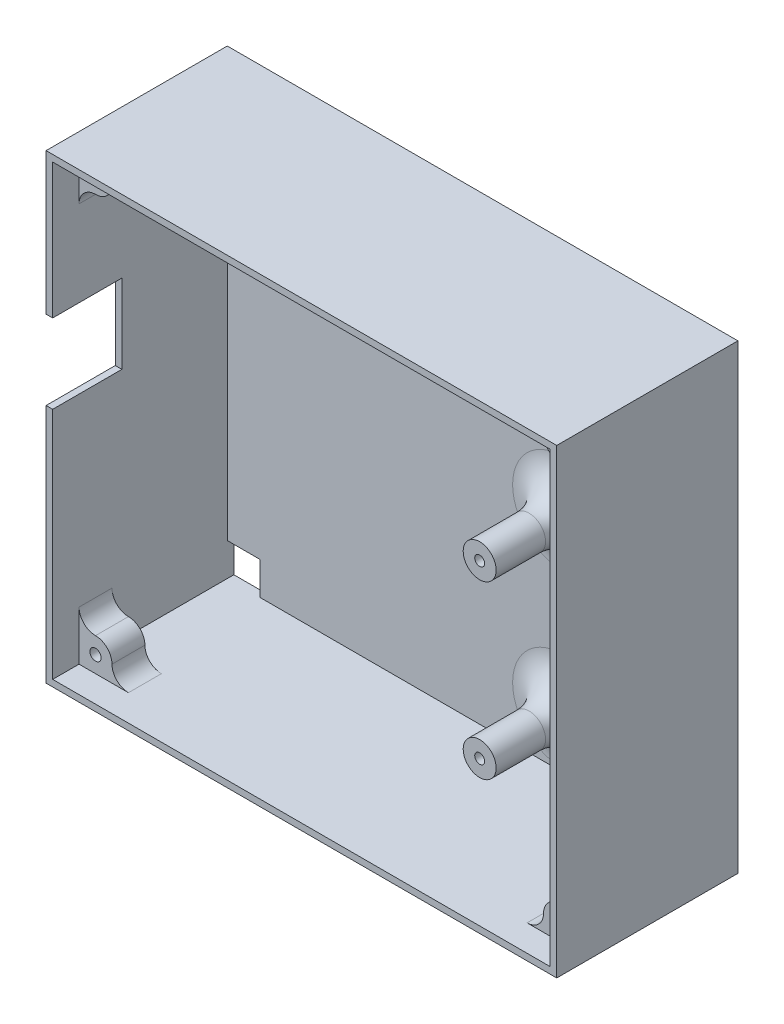
from build123d import *

# Parameters (mm, degrees)
SKIZZE1_W                            = 155
SKIZZE1_H                            = 140
AUFSATZ_LINEAR_AUSTRAGEN2_DEPTH      = 55
WANDUNG3_T                           = -2
SKIZZE2_W                            = 21
SKIZZE2_H                            = 24
SCHNITT_LINEAR_AUSTRAGEN1_DEPTH      = 2
SKIZZE3_R                            = 5
AUFSATZ_LINEAR_AUSTRAGEN5_DEPTH      = 25
VERRUNDUNG1_R                        = 10
F_3_0_3_DURCHMESSER_BOHRUNG1_D       = 3
F_3_0_3_DURCHMESSER_BOHRUNG1_DEPTH   = 20
F_3_0_3_DURCHMESSER_BOHRUNG1_TIP     = 0.901290929
SCHNITT_LINEAR_AUSTRAGEN2_REACH      = 119.112
SKIZZE6_W                            = 10
SKIZZE6_H                            = 10
AUFSATZ_LINEAR_AUSTRAGEN7_DEPTH      = 10
VERRUNDUNG3_R                        = 5
F_3_4_3_4_DURCHMESSER_BOHRUNG1_D     = 3.4
SKIZZE12_R                           = 5
AUFSATZ_LINEAR_AUSTRAGEN8_DEPTH      = 10
VERRUNDUNG4_R                        = 5
F_3_4_3_4_DURCHMESSER_BOHRUNG2_D     = 3.4
F_3_4_3_4_DURCHMESSER_BOHRUNG2_DEPTH = 10
F_3_4_3_4_DURCHMESSER_BOHRUNG2_TIP   = 1.021463052


with BuildPart() as part:
    # Skizze1 → Aufsatz-Linear austragen2 (new body)
    with BuildSketch(Plane.XY):
        Rectangle(SKIZZE1_W, SKIZZE1_H)
    extrude(amount=AUFSATZ_LINEAR_AUSTRAGEN2_DEPTH)

    # Wandung3
    wandung3_openings = [part.faces().sort_by_distance(p)[0] for p in [
        (0, 0, 55),
    ]]
    offset(amount=WANDUNG3_T, openings=wandung3_openings, kind=Kind.INTERSECTION)

    # Skizze2 → Schnitt-Linear austragen1 (cut)
    with BuildSketch(Plane.ZY.offset(77.5)):
        with Locations((44.5, 15)):
            Rectangle(SKIZZE2_W, SKIZZE2_H)
    extrude(amount=-SCHNITT_LINEAR_AUSTRAGEN1_DEPTH, mode=Mode.SUBTRACT)

    # Skizze3 → Aufsatz-Linear austragen5 (add)
    with BuildSketch(Plane.XY.offset(2)):
        with Locations(Location((26.111301189, -52, 0), (0, 0, 180))):
            Circle(SKIZZE3_R)
        with Locations(Location((26.111301189, 0, 0), (0, 0, 180))):
            Circle(SKIZZE3_R)
    extrude(amount=AUFSATZ_LINEAR_AUSTRAGEN5_DEPTH)

    # Verrundung1
    verrundung1_edges = [part.edges().sort_by_distance(p)[0] for p in [
        (31.111301189, -52, 2),
        (31.111301189, 0, 2),
    ]]
    fillet(verrundung1_edges, radius=VERRUNDUNG1_R)

    # Ø3.0 (3) Durchmesser Bohrung1
    with Locations(Plane.XY.offset(27)):
        with Locations((26.111301189, 0), (26.111301189, -52)):
            Hole(F_3_0_3_DURCHMESSER_BOHRUNG1_D / 2, depth=F_3_0_3_DURCHMESSER_BOHRUNG1_DEPTH)
            with Locations((0, 0, -(F_3_0_3_DURCHMESSER_BOHRUNG1_DEPTH + F_3_0_3_DURCHMESSER_BOHRUNG1_TIP / 2))):  # 118° drill point
                Cone(0, F_3_0_3_DURCHMESSER_BOHRUNG1_D / 2, F_3_0_3_DURCHMESSER_BOHRUNG1_TIP, mode=Mode.SUBTRACT)

    # Skizze6 → Schnitt-Linear austragen2 (cut, up to next)
    with BuildSketch(Plane.XY.offset(2), mode=Mode.PRIVATE) as schnitt_linear_austragen2_sk1:
        with Locations((-70.5, -63)):
            Rectangle(SKIZZE6_W, SKIZZE6_H)
    schnitt_linear_austragen2_tool1 = extrude(schnitt_linear_austragen2_sk1.sketch, amount=-SCHNITT_LINEAR_AUSTRAGEN2_REACH, mode=Mode.PRIVATE) & part.part
    # Skizze6 → Schnitt-Linear austragen2 (cut, up to next)
    with BuildSketch(Plane.XY.offset(2), mode=Mode.PRIVATE) as schnitt_linear_austragen2_sk2:
        with Locations((70.5, -63)):
            Rectangle(SKIZZE6_W, SKIZZE6_H)
    schnitt_linear_austragen2_tool2 = extrude(schnitt_linear_austragen2_sk2.sketch, amount=-SCHNITT_LINEAR_AUSTRAGEN2_REACH, mode=Mode.PRIVATE) & part.part
    # Skizze6 → Schnitt-Linear austragen2 (cut, up to next)
    with BuildSketch(Plane.XY.offset(2), mode=Mode.PRIVATE) as schnitt_linear_austragen2_sk3:
        with Locations((70.5, 63)):
            Rectangle(SKIZZE6_W, SKIZZE6_H)
    schnitt_linear_austragen2_tool3 = extrude(schnitt_linear_austragen2_sk3.sketch, amount=-SCHNITT_LINEAR_AUSTRAGEN2_REACH, mode=Mode.PRIVATE) & part.part
    # Skizze6 → Schnitt-Linear austragen2 (cut, up to next)
    with BuildSketch(Plane.XY.offset(2), mode=Mode.PRIVATE) as schnitt_linear_austragen2_sk4:
        with Locations((-70.5, 63)):
            Rectangle(SKIZZE6_W, SKIZZE6_H)
    schnitt_linear_austragen2_tool4 = extrude(schnitt_linear_austragen2_sk4.sketch, amount=-SCHNITT_LINEAR_AUSTRAGEN2_REACH, mode=Mode.PRIVATE) & part.part
    add(schnitt_linear_austragen2_tool1.solids().sort_by_distance((-70.5, -63, 2))[0], mode=Mode.SUBTRACT)
    add(schnitt_linear_austragen2_tool2.solids().sort_by_distance((70.5, -63, 2))[0], mode=Mode.SUBTRACT)
    add(schnitt_linear_austragen2_tool3.solids().sort_by_distance((70.5, 63, 2))[0], mode=Mode.SUBTRACT)
    add(schnitt_linear_austragen2_tool4.solids().sort_by_distance((-70.5, 63, 2))[0], mode=Mode.SUBTRACT)

    # 3D-Skizze1 → Aufsatz-Linear austragen7 (add)
    with BuildSketch(Plane(origin=(-75.5, 68, 47), x_dir=(0.7430494130276538, -0.6692365574288803, 0), z_dir=(0, 0, 1))):
        Polygon((0, 0), (7.43049413, 6.692365574), (14.122859705, -0.738128556), (6.692365574, -7.43049413), align=None)
        Polygon((112.200461367, 101.054720172), (104.769967237, 94.362354597), (111.462332811, 86.931860467), (118.892826941, 93.624226041), align=None)
        Polygon((203.216633178, 0), (195.786139047, -6.692365574), (189.093773473, 0.738128556), (196.524267603, 7.43049413), align=None)
        Polygon((91.01617181, -101.054720172), (98.446665941, -94.362354597), (91.754300366, -86.931860467), (84.323806236, -93.624226041), align=None)
    extrude(amount=-AUFSATZ_LINEAR_AUSTRAGEN7_DEPTH)

    # Verrundung3
    verrundung3_edges = [part.edges().sort_by_distance(p)[0] for p in [
        (-65.5, -58, 42),
        (-65.5, -68, 42),
        (-75.5, -58, 42),
        (75.5, -58, 42),
        (65.5, -58, 42),
        (65.5, -68, 42),
        (65.5, 58, 42),
        (65.5, 68, 42),
        (75.5, 58, 42),
        (-65.5, 58, 42),
        (-75.5, 58, 42),
        (-65.5, 68, 42),
    ]]
    fillet(verrundung3_edges, radius=VERRUNDUNG3_R - 0.0001)  # a hair under: the kernel refuses the full size

    # Ø3.4 (3.4) Durchmesser Bohrung1 (through all)
    with Locations(Plane.XY.offset(47)):
        with Locations((70.5, 63), (70.5, -63), (-70.5, -63), (-70.5, 63)):
            Hole(F_3_4_3_4_DURCHMESSER_BOHRUNG1_D / 2)

    # Skizze12 → Aufsatz-Linear austragen8 (add)
    with BuildSketch(Plane.XY.offset(2)):
        with Locations(Location((51.798054374, 44.186142646, 0), (0, 0, 180))):
            Circle(SKIZZE12_R)
        with Locations(Location((-8.201945626, 44.186142646, 0), (0, 0, 180))):
            Circle(SKIZZE12_R)
    extrude(amount=AUFSATZ_LINEAR_AUSTRAGEN8_DEPTH)

    # Verrundung4
    verrundung4_edges = [part.edges().sort_by_distance(p)[0] for p in [
        (56.798054374, 44.186142646, 2),
        (-3.201945626, 44.186142646, 2),
    ]]
    fillet(verrundung4_edges, radius=VERRUNDUNG4_R)

    # Ø3.4 (3.4) Durchmesser Bohrung2
    with Locations(Plane.XY.offset(12)):
        with Locations((51.798054374, 44.186142646), (-8.201945626, 44.186142646)):
            Hole(F_3_4_3_4_DURCHMESSER_BOHRUNG2_D / 2, depth=F_3_4_3_4_DURCHMESSER_BOHRUNG2_DEPTH)
            with Locations((0, 0, -(F_3_4_3_4_DURCHMESSER_BOHRUNG2_DEPTH + F_3_4_3_4_DURCHMESSER_BOHRUNG2_TIP / 2))):  # 118° drill point
                Cone(0, F_3_4_3_4_DURCHMESSER_BOHRUNG2_D / 2, F_3_4_3_4_DURCHMESSER_BOHRUNG2_TIP, mode=Mode.SUBTRACT)


solid = part.part
